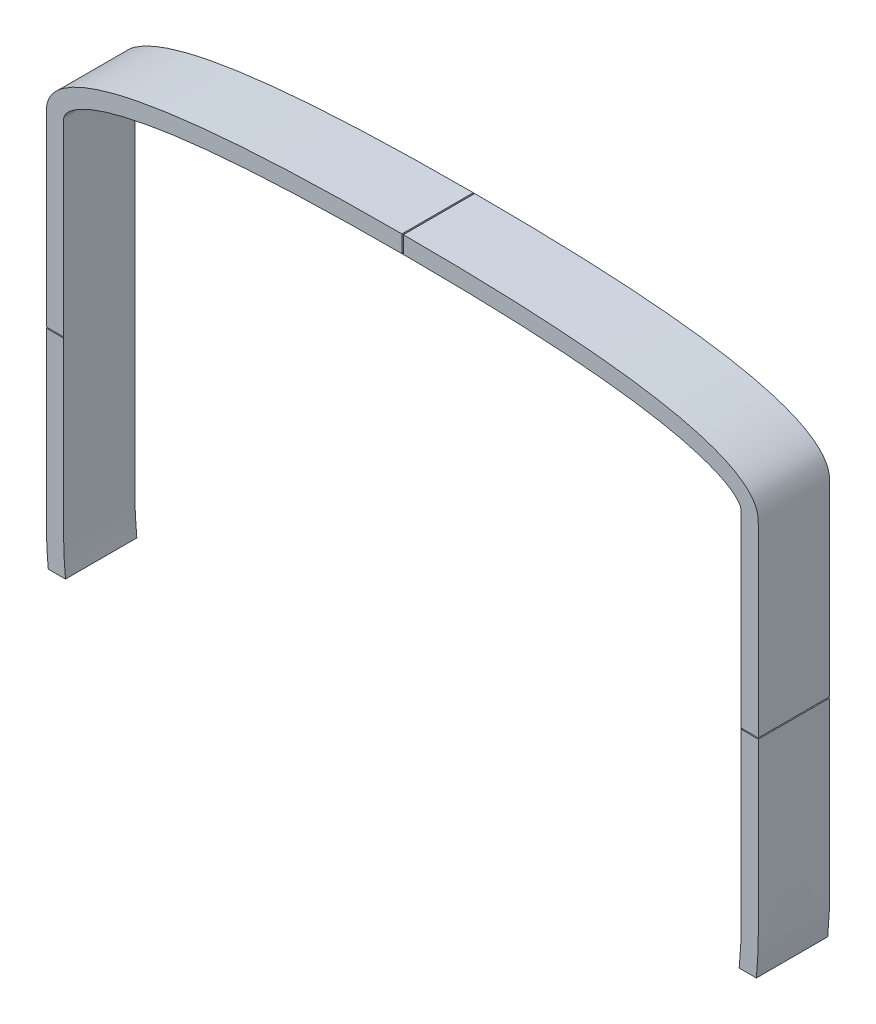
from build123d import *

# Parameters (mm, degrees)
BOSS_EXTRUDE1_DEPTH = 10
SKETCH2_W           = 250
SKETCH2_H           = 75
CUT_EXTRUDE1_DEPTH  = 158.20319004


with BuildPart() as part:
    # Sketch1 → Boss-Extrude1 (new, symmetric)
    with BuildSketch(Plane.XY):
        with BuildLine():
            Line((-95.144998716, 47.060523193), (-99.799994094, 47.060523194))
            add(Edge.make_bspline(
                [(-99.799994094, 47.060523194), (-99.800007021, 46.135711354), (-99.800068705, 41.700388492), (-99.80014587, 33.754485116), (-99.800505635, 23.223179801), (-99.799679386, 14.4459308), (-99.801136798, 7.426624709), (-99.796894787, 3.033822239), (-99.805308217, -0.465987616), (-99.759141694, -4.156711462), (-99.438712731, -10.542299727), (-98.294238748, -19.729972222), (-95.501671637, -30.617877434), (-91.007467852, -41.089742593), (-84.652074349, -50.663569653), (-76.600245778, -58.862795915), (-67.302957766, -65.435861427), (-53.896056792, -72.115410588), (-36.165000884, -77.150562875), (-18.187624636, -79.297714349), (-6.174368209, -79.759810132), (-1.346346859, -79.801016691), (-0.1, -79.801808559)],
                knots=[0.37088373, 0.37088373, 0.37088373, 0.37088373, 0.375, 0.390625, 0.40625, 0.421875, 0.4296875, 0.4375, 0.44140625, 0.4453125, 0.453125, 0.46875, 0.484375, 0.5, 0.515625, 0.53125, 0.546875, 0.5625, 0.59375, 0.625, 0.640625, 0.64606282, 0.64606282, 0.64606282, 0.64606282], degree=3))
            Line((-0.1, -79.801808559), (-0.1, -75.146205503))
            Line((-0.1, -75.146205503), (0.3, -75.146205503))
            Line((0.3, -75.146205503), (0.3, -79.801724394))
            add(Edge.make_bspline(
                [(0.3, -79.801724394), (2.501532566, -79.799397871), (11.86466932, -79.658552731), (28.468647656, -78.393184478), (49.892541186, -73.78340807), (67.095318032, -66.050228552), (79.086640147, -56.648120321), (86.680517748, -48.016317429), (92.501583857, -38.117867323), (96.476354993, -27.483349983), (98.433155067, -18.360856768), (99.337729137, -11.029098552), (99.655135353, -6.445613725), (99.780918083, -2.7912996), (99.804296451, -0.038361832), (99.799067761, 2.584352582), (99.800472354, 6.091701714), (99.799858203, 10.482871902), (99.800080901, 17.502278893), (99.799972511, 26.279386709), (99.800007066, 36.716753999), (99.800001274, 43.643913188), (99.800000093, 47.060523193)],
                knots=[0.646644559, 0.646644559, 0.646644559, 0.646644559, 0.65625, 0.6875, 0.71875, 0.75, 0.765625, 0.78125, 0.796875, 0.8125, 0.828125, 0.8359375, 0.84375, 0.84765625, 0.8515625, 0.85546875, 0.859375, 0.8671875, 0.875, 0.890625, 0.90625, 0.921457001, 0.921457001, 0.921457001, 0.921457001], degree=3))
            Line((99.800000093, 47.060523193), (95.144998716, 47.060523193))
            Line((95.144998716, 47.060523193), (95.144998716, 47.360523193))
            Line((95.144998716, 47.360523193), (99.799999994, 47.360523193))
            add(Edge.make_bspline(
                [(99.799999994, 47.360523193), (99.799998891, 50.864959172), (99.80000025, 56.124633568), (99.799999953, 63.139577639), (99.800000013, 68.405348483), (99.799999997, 73.671119926), (99.800000001, 78.936891125), (99.799999999, 83.325034106), (99.800000002, 86.835547857), (99.799999994, 89.468434883), (99.800000017, 91.66250196), (99.799999971, 93.417767831), (99.800000113, 94.734183873), (99.799999668, 95.831303359), (99.800000573, 96.708760922), (99.799997771, 97.367504686), (99.800007811, 98.023774591), (99.799972215, 98.578528019), (99.80002125, 99.006164906), (99.800066327, 99.295458307), (99.799683962, 99.514410156), (99.799726653, 99.677266334), (99.802643895, 99.88249116), (99.799343805, 100.0793429)],
                knots=[0.921902091, 0.921902091, 0.921902091, 0.921902091, 0.9375, 0.9453125, 0.953125, 0.9609375, 0.96875, 0.9765625, 0.98046875, 0.984375, 0.98828125, 0.990234375, 0.9921875, 0.994140625, 0.995117188, 0.99609375, 0.997070312, 0.998046875, 0.998535156, 0.999023438, 0.999267578, 0.999511719, 1, 1, 1, 1], degree=3))
            add(Edge.make_bspline(
                [(99.799343805, 100.0793429), (99.79769376, 100.17776877), (99.791771211, 100.404638105), (99.756702617, 100.866154781), (99.681026069, 101.371255742), (99.474830418, 102.302594526), (98.978403603, 103.522379935), (98.211060015, 104.706394838), (97.450923574, 105.606725476), (96.716844631, 106.336037386), (95.739744321, 107.177590333), (94.550465009, 108.03359409), (93.145100655, 108.89131757), (91.75533098, 109.626968724), (90.375947661, 110.276323768), (88.554940758, 111.047853828), (86.286312413, 111.884188002), (83.582091496, 112.733611142), (80.886327919, 113.473235038), (77.306216569, 114.338576161), (72.837150711, 115.246978295), (67.491102847, 116.127565447), (62.153711112, 116.857717776), (55.050159396, 117.6648435), (46.179815673, 118.430829138), (35.555435733, 119.056758148), (24.944271633, 119.472818285), (13.189948298, 119.737206297), (4.980994135, 119.801279512), (0.3, 119.80199352)],
                knots=[0, 0, 0, 0, 0.000244141, 0.000488281, 0.000732422, 0.000976562, 0.001953125, 0.002929688, 0.00390625, 0.004882812, 0.005859375, 0.0078125, 0.009765625, 0.01171875, 0.013671875, 0.015625, 0.01953125, 0.0234375, 0.02734375, 0.03125, 0.0390625, 0.046875, 0.0546875, 0.0625, 0.078125, 0.09375, 0.109375, 0.125, 0.145729296, 0.145729296, 0.145729296, 0.145729296], degree=3))
            Line((0.3, 119.80199352), (0.3, 115.145563586))
            Line((0.3, 115.145563586), (-0.1, 115.145563586))
            Line((-0.1, 115.145563586), (-0.1, 119.801967426))
            add(Edge.make_bspline(
                [(-0.1, 119.801967426), (-2.342411795, 119.801333265), (-8.113407772, 119.77860499), (-17.418616824, 119.658563661), (-28.020749242, 119.370598285), (-38.634834441, 118.900042221), (-49.263994287, 118.195660199), (-58.13525568, 117.350230931), (-65.248057918, 116.451417193), (-70.587886107, 115.637667365), (-75.94234067, 114.643364254), (-80.414328561, 113.614336255), (-84.011794221, 112.606570277), (-86.715444626, 111.737306732), (-88.990738285, 110.875491127), (-90.811622866, 110.078868363), (-92.196773222, 109.402861837), (-93.584786341, 108.637685085), (-94.773007795, 107.876037667), (-95.717641092, 107.178431545), (-96.449965322, 106.576000015), (-97.186184014, 105.883016407), (-97.928763991, 105.062911858), (-98.573473095, 104.17184846), (-99.06327665, 103.27043995), (-99.393526391, 102.489659032), (-99.614870682, 101.719827952), (-99.727313202, 101.084699763), (-99.769423265, 100.710384113), (-99.790336747, 100.411353638), (-99.799235979, 100.166724504), (-99.800205476, 99.984508899), (-99.799847623, 99.869027792), (-99.799823906, 99.74060093), (-99.799792486, 99.523798108), (-99.80002485, 99.25143402), (-99.800288052, 98.810752814), (-99.800517977, 98.261733031), (-99.800636847, 97.602387822), (-99.800637755, 96.723799284), (-99.800418096, 95.626005841), (-99.800042438, 94.309623403), (-99.799832205, 92.994001879), (-99.799782847, 91.239340091), (-99.799981835, 89.045558241), (-99.800160348, 86.412399842), (-99.800244895, 83.779420706), (-99.800272173, 80.268756937), (-99.800180454, 75.88050538), (-99.800003308, 70.614722004), (-99.79990146, 65.349029555), (-99.799872223, 60.083306937), (-99.799896006, 54.087142812), (-99.799955137, 49.846215152), (-99.799989899, 47.360523194)],
                knots=[0.146319748, 0.146319748, 0.146319748, 0.146319748, 0.15625, 0.171875, 0.1875, 0.203125, 0.21875, 0.234375, 0.2421875, 0.25, 0.2578125, 0.265625, 0.26953125, 0.2734375, 0.27734375, 0.279296875, 0.28125, 0.283203125, 0.28515625, 0.286132812, 0.287109375, 0.288085938, 0.2890625, 0.290039062, 0.290527344, 0.291015625, 0.291503906, 0.291748047, 0.291992188, 0.292114258, 0.292236328, 0.292358398, 0.292480469, 0.292724609, 0.29296875, 0.293457031, 0.293945312, 0.294921875, 0.295898438, 0.296875, 0.298828125, 0.30078125, 0.302734375, 0.3046875, 0.30859375, 0.3125, 0.31640625, 0.3203125, 0.328125, 0.3359375, 0.34375, 0.3515625, 0.359375, 0.370438637, 0.370438637, 0.370438637, 0.370438637], degree=3))
            Line((-99.799989899, 47.360523194), (-95.144998716, 47.360523193))
            Line((-95.144998716, 47.360523193), (-95.144998716, 47.060523193))
        make_face()
        with BuildLine():
            add(Edge.make_bspline(
                [(95, 99.9999764), (94.998158654, 100.111323776), (94.988555492, 100.330452079), (94.928497736, 100.650738133), (94.829433653, 100.960373571), (94.562305646, 101.554381223), (93.979381252, 102.319240831), (93.026321659, 103.206894733), (91.676242438, 104.196155839), (89.764336677, 105.289109327), (86.722535982, 106.65506279), (82.554332223, 108.082970586), (76.113161241, 109.753501279), (67.445465525, 111.354602755), (54.260097881, 113.017880155), (36.673333772, 114.303280105), (21.096742339, 114.795958764), (10.107934879, 114.951244021), (4.90353807, 114.992504049), (-0.322483783, 115.004815996), (-7.3651861, 114.983564876), (-16.031122652, 114.882852335), (-26.963634466, 114.606505108), (-37.955965783, 114.136610186), (-48.857717823, 113.411493768), (-58.667004405, 112.474338886), (-66.629478523, 111.426131298), (-72.931735306, 110.3437474), (-78.167831479, 109.236295863), (-83.130416471, 107.912106678), (-87.312276912, 106.426045165), (-90.342572834, 104.992935461), (-92.21152013, 103.84448353), (-93.358305632, 102.913020094), (-93.97668009, 102.284806185), (-94.53132619, 101.602044508), (-94.896611638, 100.907705453), (-94.986875212, 100.309217247), (-95.000321451, 100.090667807), (-94.999611402, 99.760684992), (-95.001345658, 97.724085186), (-94.999452202, 93.980426074), (-95.00058471, 84.227615871), (-94.999736182, 68.372971062), (-95.00003311, 40.187168716), (-95.000534612, 17.476051094), (-94.999924912, 2.196714309), (-95.000177274, 0.435157827), (-94.998228748, -2.332268019), (-94.810105559, -8.199272197), (-93.871284142, -17.144653487), (-91.432249232, -27.575340796), (-87.850239506, -36.456262715), (-83.683778334, -43.555042899), (-79.318518097, -49.212412524), (-73.508761462, -55.035501078), (-65.814198627, -60.71878416), (-56.809924782, -65.370143365), (-47.639489074, -68.795115094), (-37.877110836, -71.453415015), (-26.887713018, -73.43008817), (-15.418130014, -74.581308404), (-6.148458685, -74.967857061), (0.891896226, -75.017340521), (7.960377027, -74.915107437), (16.784772866, -74.468314785), (27.313255297, -73.335911103), (37.740953191, -71.474587563), (51.381892539, -67.828456194), (64.481920694, -61.968992844), (74.295409671, -54.310428112), (79.225965526, -49.215189273), (83.603106958, -43.746277093), (88.134079606, -36.084451181), (91.828286828, -26.213569542), (94.081892112, -15.744880147), (94.815561187, -7.825596661), (94.971539529, -2.876580077), (94.99682394, -1.126336408), (95.001808453, 0.624296271), (94.999406626, 2.831564682), (95.000343414, 6.333130188), (94.999876147, 10.710085088), (95.0000018, 14.328368425), (94.99999993, 16.312588233), (95.000000019, 16.662744668), (94.999999995, 17.012901104), (95.000000001, 17.36305754), (95, 17.713213976), (95, 18.063370412), (95, 18.413526848), (95, 18.763683284), (95, 19.113839719), (95, 19.463996155), (95, 19.814152591), (95, 20.164309027), (95, 20.514465463), (95, 20.864621899), (95, 21.214778334), (95, 21.56493477), (95, 21.915091206), (95, 22.265247642), (95, 22.615404078), (95, 22.965560514), (95, 23.31571695), (95, 23.665873385), (95, 24.016029821), (95, 24.366186257), (95, 24.716342693), (95, 25.066499129), (95, 25.416655565), (95, 25.766812), (95, 26.116968436), (95, 26.467124872), (95, 26.817281308), (95, 27.167437744), (95, 27.51759418), (95, 27.867750616), (95, 28.217907051), (95, 28.568063487), (95, 28.918219923), (95, 29.268376359), (95, 29.618532795), (95, 29.968689231), (95, 30.318845666), (95, 30.669002102), (95, 31.019158538), (95, 31.369314974), (95, 31.71947141), (95, 32.069627846), (95, 32.419784282), (95, 32.769940717), (95, 33.120097153), (95, 33.470253589), (95, 33.820410025), (95, 34.170566461), (95, 34.520722897), (95, 34.870879332), (95, 35.221035768), (95, 35.571192204), (95, 35.92134864), (95, 36.271505076), (95, 36.621661512), (95, 36.971817947), (95, 37.321974383), (95, 37.672130819), (95, 38.022287255), (95, 38.372443691), (95, 38.722600127), (95, 39.072756563), (95, 39.422912998), (95, 39.773069434), (95, 40.12322587), (95, 40.473382306), (95, 40.823538742), (95, 41.173695178), (95, 41.523851613), (95, 41.874008049), (95, 42.224164485), (95, 42.574320921), (95, 42.924477357), (95, 43.274633793), (95, 43.624790229), (95, 43.974946664), (95, 44.3251031), (95, 44.675259536), (95, 45.025415972), (95, 45.375572408), (95, 45.725728844), (95, 46.075885279), (95, 46.426041715), (95, 46.776198151), (95, 47.126354587), (95, 47.476511023), (95, 47.826667459), (95, 48.176823895), (95, 48.52698033), (95, 48.877136766), (95, 49.227293202), (95, 49.577449638), (95, 49.927606074), (95, 50.27776251), (95, 50.627918945), (95, 50.978075381), (95, 51.328231817), (95, 51.678388253), (95, 52.028544689), (95, 52.378701125), (95, 52.728857561), (95, 53.079013996), (95, 53.429170432), (95, 53.779326868), (95, 54.129483304), (95, 54.47963974), (95, 54.829796176), (95, 55.179952611), (95, 55.530109047), (95, 55.880265483), (95, 56.230421919), (95, 56.580578355), (95, 56.930734791), (95, 57.280891227), (95, 57.631047662), (95, 57.981204098), (95, 58.331360534), (95, 58.68151697), (95, 59.031673406), (95, 59.381829842), (95, 59.731986277), (95, 60.082142713), (95, 60.432299149), (95, 60.782455585), (95, 61.132612021), (95, 61.482768457), (95, 61.832924893), (95, 62.183081328), (95, 62.533237764), (95, 62.8833942), (95, 63.233550636), (95, 63.583707072), (95, 63.933863508), (95, 64.284019943), (95, 64.634176379), (95, 64.984332815), (95, 65.334489251), (95, 65.684645687), (95, 66.034802123), (95, 66.384958558), (95, 66.735114994), (95, 67.08527143), (95, 67.435427866), (95, 67.785584302), (95, 68.135740738), (95, 68.485897174), (95, 68.836053609), (95, 69.186210045), (95, 69.536366481), (95, 69.886522917), (95, 70.236679353), (95, 70.586835789), (95, 70.936992224), (95, 71.28714866), (95, 71.637305096), (95, 71.987461532), (95, 72.337617968), (95, 72.687774404), (95, 73.03793084), (95, 73.388087275), (95, 73.738243711), (95, 74.088400147), (95, 74.438556583), (95, 74.788713019), (95, 75.138869455), (95, 75.48902589), (95, 75.839182326), (95, 76.189338762), (95, 76.539495198), (95, 76.889651634), (95, 77.23980807), (95, 77.589964506), (95, 77.940120941), (95, 78.290277377), (95, 78.640433813), (95, 78.990590249), (95, 79.340746685), (95, 79.690903121), (95, 80.041059556), (95, 80.391215992), (95, 80.741372428), (95, 81.091528864), (95, 81.4416853), (95, 81.791841736), (95, 82.141998172), (95, 82.492154607), (95, 82.842311043), (95, 83.192467479), (95, 83.542623915), (95, 83.892780351), (95, 84.242936787), (95, 84.593093222), (95, 84.943249658), (95, 85.293406094), (95, 85.64356253), (95, 85.993718966), (95, 86.343875402), (95, 86.694031838), (95, 87.044188273), (95, 87.394344709), (95, 87.744501145), (95, 88.094657581), (95, 88.444814017), (95, 88.794970453), (95, 89.145126888), (95, 89.495283324), (95, 89.84543976), (95, 90.195596196), (95, 90.545752632), (95, 90.895909068), (95, 91.246065504), (95, 91.596221939), (95, 91.946378375), (95, 92.296534811), (95, 92.646691247), (95, 92.996847683), (95, 93.347004119), (95, 93.697160554), (95, 94.04731699), (95, 94.397473426), (95, 94.747629862), (95, 95.097786298), (95, 95.447942734), (95, 95.798099169), (94.999999998, 96.148255605), (95.000000006, 96.498412041), (94.999999976, 96.848568478), (95.000000089, 97.198724911), (94.999999668, 97.548881356), (95.000001238, 97.899037757), (94.999995381, 98.249194325), (95.00001724, 98.599350267), (94.999935661, 98.949508546), (95.000240118, 99.299658103), (94.999103869, 99.649840208), (95.001930894, 99.883213967), (95, 99.9999764)],
                knots=[0, 0, 0, 0, 0.000495413, 0.000974356, 0.001445521, 0.001939312, 0.003867498, 0.005664183, 0.007730435, 0.011300748, 0.015444534, 0.022555493, 0.030881167, 0.045043753, 0.061751684, 0.090013261, 0.123491819, 0.131103125, 0.138928425, 0.146656694, 0.154363659, 0.170274933, 0.185229484, 0.203037369, 0.219241711, 0.233853899, 0.246889497, 0.254977191, 0.262309713, 0.270703955, 0.277822243, 0.282027633, 0.285605197, 0.287554362, 0.288588997, 0.28952012, 0.291476388, 0.29196221, 0.292205708, 0.292450459, 0.293430559, 0.301271361, 0.309112163, 0.336840089, 0.371838576, 0.43456499, 0.437925334, 0.43984553, 0.44240556, 0.450242671, 0.46596488, 0.482358403, 0.497762126, 0.508387704, 0.518904365, 0.529479595, 0.544907773, 0.561269893, 0.574423016, 0.588416061, 0.606247981, 0.624054608, 0.639683002, 0.647524959, 0.655389317, 0.671145562, 0.686832306, 0.702494704, 0.718232126, 0.749658545, 0.765474223, 0.773344002, 0.781172907, 0.796611323, 0.812727204, 0.827870456, 0.844150207, 0.848045333, 0.849909138, 0.851940932, 0.855837224, 0.859733515, 0.867526097, 0.87531868, 0.875838185, 0.876357691, 0.876877196, 0.877396702, 0.877916207, 0.878435713, 0.878955218, 0.879474724, 0.879994229, 0.880513735, 0.88103324, 0.881552746, 0.882072251, 0.882591757, 0.883111262, 0.883630768, 0.884150273, 0.884669779, 0.885189284, 0.88570879, 0.886228295, 0.886747801, 0.887267306, 0.887786812, 0.888306317, 0.888825823, 0.889345328, 0.889864834, 0.890384339, 0.890903845, 0.89142335, 0.891942856, 0.892462361, 0.892981867, 0.893501372, 0.894020878, 0.894540383, 0.895059889, 0.895579394, 0.8960989, 0.896618405, 0.897137911, 0.897657416, 0.898176922, 0.898696427, 0.899215933, 0.899735438, 0.900254944, 0.900774449, 0.901293955, 0.90181346, 0.902332966, 0.902852471, 0.903371977, 0.903891482, 0.904410988, 0.904930493, 0.905449999, 0.905969504, 0.90648901, 0.907008515, 0.907528021, 0.908047526, 0.908567032, 0.909086537, 0.909606043, 0.910125548, 0.910645054, 0.911164559, 0.911684065, 0.91220357, 0.912723076, 0.913242581, 0.913762087, 0.914281592, 0.914801098, 0.915320603, 0.915840109, 0.916359614, 0.91687912, 0.917398625, 0.917918131, 0.918437636, 0.918957142, 0.919476647, 0.919996153, 0.920515658, 0.921035164, 0.921554669, 0.922074175, 0.92259368, 0.923113186, 0.923632691, 0.924152197, 0.924671702, 0.925191208, 0.925710713, 0.926230219, 0.926749724, 0.92726923, 0.927788735, 0.928308241, 0.928827746, 0.929347252, 0.929866757, 0.930386263, 0.930905768, 0.931425274, 0.931944779, 0.932464285, 0.93298379, 0.933503296, 0.934022801, 0.934542307, 0.935061812, 0.935581318, 0.936100823, 0.936620329, 0.937139834, 0.93765934, 0.938178845, 0.938698351, 0.939217856, 0.939737362, 0.940256867, 0.940776373, 0.941295878, 0.941815384, 0.942334889, 0.942854395, 0.9433739, 0.943893406, 0.944412911, 0.944932417, 0.945451922, 0.945971428, 0.946490933, 0.947010439, 0.947529944, 0.94804945, 0.948568955, 0.949088461, 0.949607966, 0.950127472, 0.950646977, 0.951166483, 0.951685988, 0.952205494, 0.952724999, 0.953244505, 0.95376401, 0.954283516, 0.954803021, 0.955322527, 0.955842032, 0.956361538, 0.956881043, 0.957400549, 0.957920054, 0.95843956, 0.958959065, 0.959478571, 0.959998076, 0.960517582, 0.961037087, 0.961556593, 0.962076098, 0.962595604, 0.963115109, 0.963634615, 0.96415412, 0.964673626, 0.965193131, 0.965712637, 0.966232142, 0.966751648, 0.967271153, 0.967790659, 0.968310164, 0.96882967, 0.969349175, 0.969868681, 0.970388186, 0.970907692, 0.971427197, 0.971946703, 0.972466208, 0.972985714, 0.973505219, 0.974024725, 0.97454423, 0.975063736, 0.975583241, 0.976102747, 0.976622252, 0.977141758, 0.977661263, 0.978180769, 0.978700274, 0.97921978, 0.979739285, 0.980258791, 0.980778296, 0.981297802, 0.981817307, 0.982336813, 0.982856318, 0.983375824, 0.983895329, 0.984414835, 0.98493434, 0.985453846, 0.985973351, 0.986492857, 0.987012362, 0.987531868, 0.988051373, 0.988570879, 0.989090384, 0.98960989, 0.990129395, 0.990648901, 0.991168406, 0.991687912, 0.992207417, 0.992726923, 0.993246428, 0.993765934, 0.994285439, 0.994804945, 0.99532445, 0.995843956, 0.996363461, 0.996882967, 0.997402472, 0.997921978, 0.998441483, 0.998960989, 0.999480494, 1, 1, 1, 1], degree=3))
        make_face(mode=Mode.SUBTRACT)
    extrude(amount=BOSS_EXTRUDE1_DEPTH, both=True)

    # Sketch2 → Cut-Extrude1 (cut, through all)
    with BuildSketch(Plane.XY.offset(10)):
        with Locations((-0.1, -48.698032574)):
            Rectangle(SKETCH2_W, SKETCH2_H)
    extrude(amount=-CUT_EXTRUDE1_DEPTH, mode=Mode.SUBTRACT)


solid = part.part
